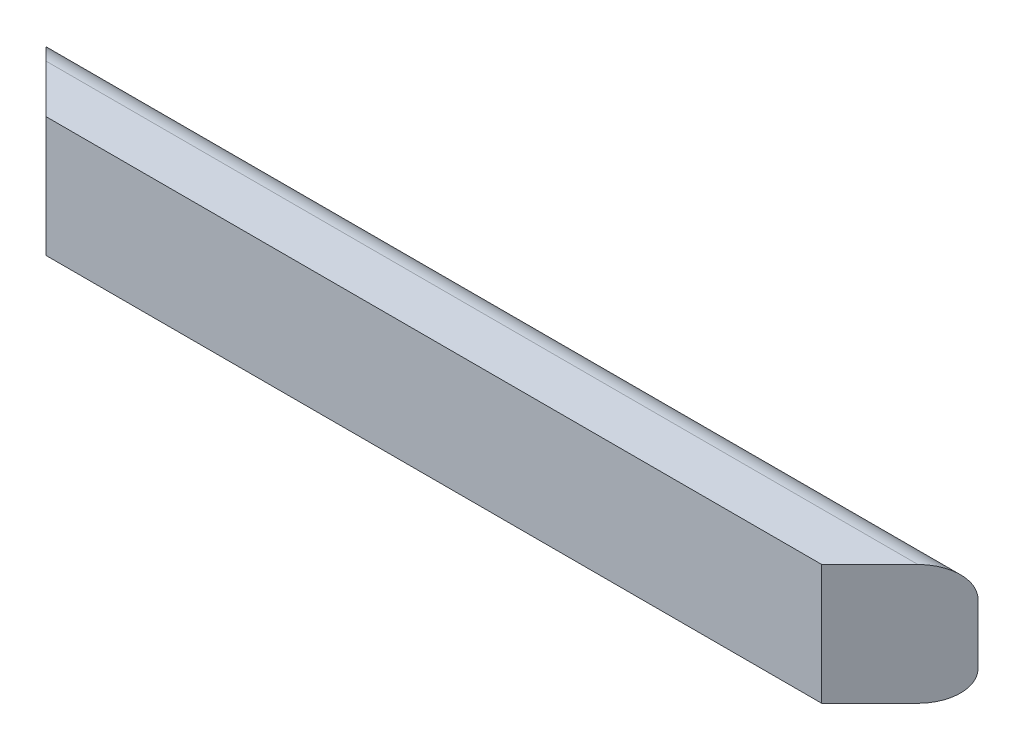
from build123d import *

# Parameters (mm, degrees)
BOSS_EXTRUDE1_DEPTH = 984.25
SKETCH2_W           = 344.402501539
SKETCH2_H           = 493.213131915
CUT_EXTRUDE1_DEPTH  = 752.677478211


with BuildPart() as part:
    # Sketch1 → Boss-Extrude1 (new body)
    with BuildSketch(Plane(origin=(0, 0, 0), x_dir=(0, 0, -1), z_dir=(1, 0, 0))):
        with BuildLine():
            Line((0, 0), (31.75, 0))
            ThreePointArc((31.75, 0), (54.200640303, 9.299359697), (63.5, 31.75))
            Line((63.5, 31.75), (63.5, 95.25))
            ThreePointArc((63.5, 95.25), (54.200640303, 117.700640303), (31.75, 127))
            Line((31.75, 127), (0, 127))
            Line((0, 127), (-19.05, 127))
            Line((-19.05, 127), (-19.05, 0))
            Line((-19.05, 0), (0, 0))
        make_face()
    extrude(amount=BOSS_EXTRUDE1_DEPTH)

    # Sketch2 → Cut-Extrude1 (cut, through all)
    with BuildSketch(Plane(origin=(460.375, 0, 460.375), x_dir=(0, 1, 0), z_dir=(0.7071067811865464, 0, 0.7071067811865488))):
        with Locations((32.995160032, -679.680893327)):
            Rectangle(SKETCH2_W, SKETCH2_H)
    cut_extrude1 = extrude(amount=CUT_EXTRUDE1_DEPTH, mode=Mode.SUBTRACT)

    # Mirror1: Cut-Extrude1 across plane
    add(cut_extrude1.mirror(Plane(origin=(492.125, 0, 0), x_dir=(0, 0, 1), z_dir=(1, 0, 0))), mode=Mode.SUBTRACT)


solid = part.part
